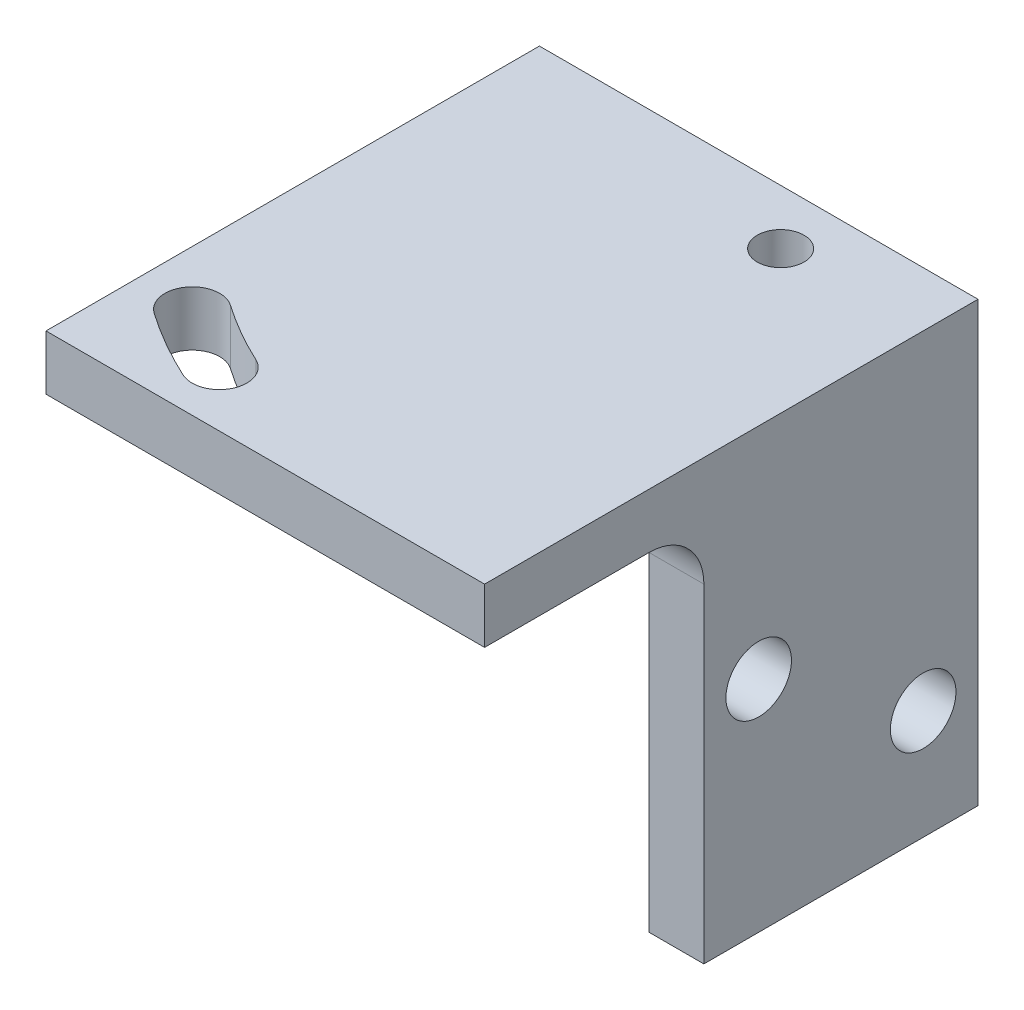
from build123d import *

# Parameters (mm, degrees)
BOSS_EXTRUDE1_DEPTH   = 28.575
F_6_32_TAPPED_HOLE1_D = 2.7051
F_6_CLEARANCE_HOLE1_D = 3.7973
SKETCH8_R             = 1.35255
CUT_EXTRUDE1_DEPTH    = 46.900442536
SKETCH9_W             = 12.7
SKETCH9_H             = 22.225
CUT_EXTRUDE2_DEPTH    = 45.22263278
FILLET1_R             = 3.175


with BuildPart() as part:
    # Sketch1 → Boss-Extrude1 (new body)
    with BuildSketch(Plane.XY):
        Polygon((0, -25.4), (0, 0), (-25.4, 0), (-25.4, -3.175), (-3.175, -3.175), (-3.175, -25.4), align=None)
    extrude(amount=BOSS_EXTRUDE1_DEPTH)

    # #6-32 Tapped Hole1 (through all)
    with Locations(Plane(origin=(-8.255, 0, 3.175), x_dir=(1, 0, 0), z_dir=(0, 1, 0))):
        with Locations((0, 0), (-10.3, -22.2)):
            Hole(F_6_32_TAPPED_HOLE1_D / 2)

    # #6 Clearance Hole1 (through all)
    with Locations(Plane(origin=(-3.175, -12.7, 12.7), x_dir=(0, -1, 0), z_dir=(-1, 0, 0))):
        with Locations((0, 0), (6.35, -9.525)):
            Hole(F_6_CLEARANCE_HOLE1_D / 2)

    # Sketch8 → Cut-Extrude1 (cut, through all)
    with BuildSketch(Plane(origin=(0, 0, 0), x_dir=(1, 0, 0), z_dir=(0, 1, 0))):
        with BuildLine():
            ThreePointArc((-17.886866841, -23.934946413), (-19.659563303, -23.016475999), (-21.345464145, -21.946999958))
            ThreePointArc((-21.345464145, -21.946999958), (-23.555665329, -22.341110631), (-23.161554656, -24.551311816))
            ThreePointArc((-23.161554656, -24.551311816), (-21.241762383, -25.769160338), (-19.223133007, -26.815053657))
            ThreePointArc((-19.223133007, -26.815053657), (-17.114946378, -26.043133083), (-17.886866841, -23.934946413))
        make_face()
        with Locations((-18.555, -25.375)):
            Circle(SKETCH8_R, mode=Mode.SUBTRACT)
    extrude(amount=-CUT_EXTRUDE1_DEPTH, mode=Mode.SUBTRACT)

    # Sketch9 → Cut-Extrude2 (cut, through all)
    with BuildSketch(Plane.ZY.offset(3.175)):
        with Locations((22.225, -14.2875)):
            Rectangle(SKETCH9_W, SKETCH9_H)
    extrude(amount=-CUT_EXTRUDE2_DEPTH, mode=Mode.SUBTRACT)

    # Fillet1
    fillet1_edges = [part.edges().sort_by_distance(p)[0] for p in [
        (-3.175, -3.175, 7.9375),
        (-1.5875, -3.175, 15.875),
    ]]
    fillet(fillet1_edges, radius=FILLET1_R)


solid = part.part
